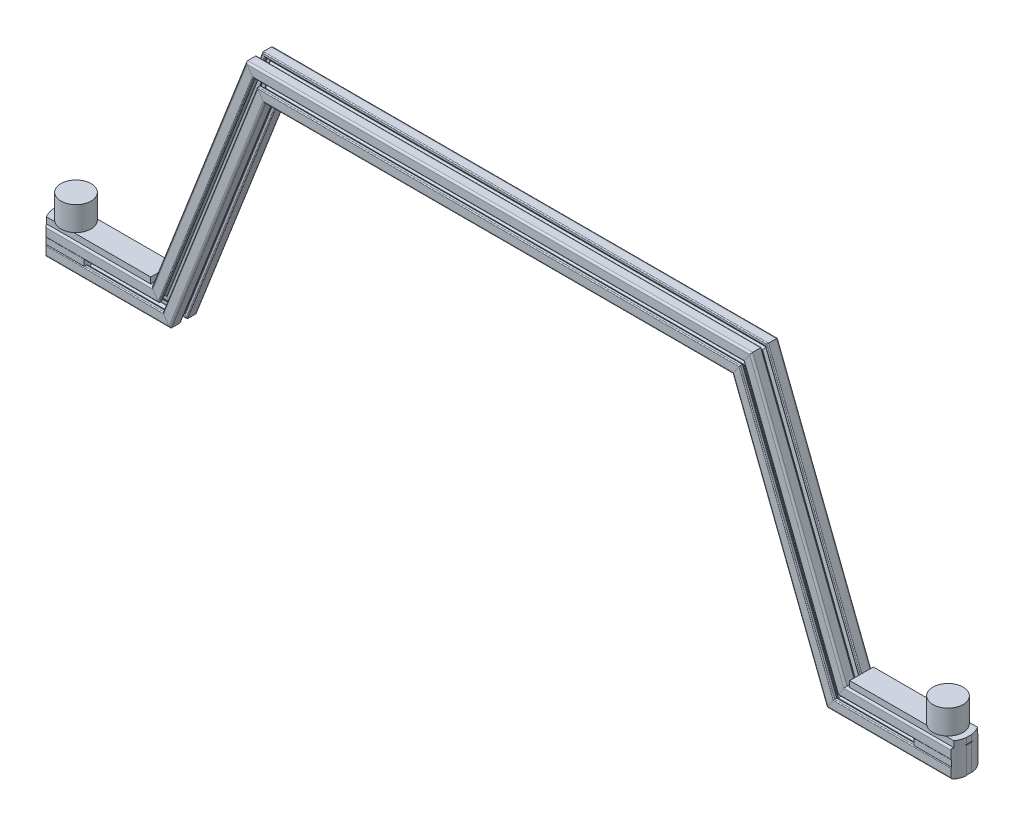
from build123d import *

# Parameters (mm, degrees)
SKETCH3_W           = 177.95649801978897
SKETCH3_H           = 38.99999999999999
BOSS_EXTRUDE1_DEPTH = 10
SKETCH4_R           = 25.000000000000004
BOSS_EXTRUDE2_DEPTH = 40
BOSS_EXTRUDE3_DEPTH = 70
CUT_EXTRUDE1_REACH  = 853.071


with BuildPart() as part:
    # Sweep1: sweep along a path in Sketch1
    with BuildLine(Plane.XY) as sweep1_path:
        Line((0, 0), (200, 0))
        Line((200, 0), (355.8974358974359, 400))
        Line((355.8974358974359, 400), (755.8974358974359, 400))
    # Sketch7 → Sweep1 (sweep)
    with BuildSketch(Plane(origin=(0, 0, 0), x_dir=(0, 0, -1), z_dir=(1, 0, 0))):
        with BuildLine():
            Line((4.905816029016867, 11.21531925961758), (4.005816102684597, 10.70017121598502))
            Line((4.005816102684597, 10.70017121598502), (3.105816176352211, 11.21531925961758))
            Line((3.105816176352211, 11.21531925961758), (-2.1975082146962652, 11.215319259617562))
            ThreePointArc((-2.1975082146962652, 11.215319259617562), (-2.3429279189949894, 11.244245037263257), (-2.4662087915471362, 11.326618682766647))
            Line((-2.4662087915471362, 11.326618682766647), (-5.932884474166096, 14.79329436538555))
            ThreePointArc((-5.932884474166096, 14.79329436538555), (-6.015258119669531, 14.9165752379377), (-6.044183897315248, 15.06199494223645))
            Line((-6.044183897315248, 15.06199494223645), (-6.044183897315358, 19.35531925961757))
            ThreePointArc((-6.044183897315358, 19.35531925961757), (-5.93288447416625, 19.62401983646846), (-5.664183897315362, 19.73531925961757))
            Line((-5.664183897315362, 19.73531925961757), (-2.5791838973153265, 19.73531925961757))
            ThreePointArc((-2.5791838973153265, 19.73531925961757), (-1.5043815899117716, 20.180516952214003), (-1.0591838973153256, 21.25531925961755))
            Line((-1.0591838973153256, 21.25531925961755), (-1.059183897315572, 24.21531925961759))
            ThreePointArc((-1.059183897315572, 24.21531925961759), (-1.504381589912015, 25.290121567021124), (-2.579183897315554, 25.73531925961756))
            Line((-2.579183897315554, 25.73531925961756), (-15.4941838973154, 25.73531925961757))
            ThreePointArc((-15.4941838973154, 25.73531925961757), (-17.61550424087504, 24.85663960317721), (-18.4941838973154, 22.735319259617572))
            Line((-18.4941838973154, 22.735319259617572), (-18.4941838973154, 9.820319259617662))
            ThreePointArc((-18.4941838973154, 9.820319259617662), (-18.048986204718968, 8.745516952214107), (-16.97418389731542, 8.300319259617662))
            Line((-16.97418389731542, 8.300319259617662), (-14.014183897315382, 8.300319259617766))
            ThreePointArc((-14.014183897315382, 8.300319259617766), (-12.939381589911845, 8.745516952214206), (-12.494183897315379, 9.820319259617733))
            Line((-12.494183897315379, 9.820319259617733), (-12.4941838973154, 12.90531925961758))
            ThreePointArc((-12.4941838973154, 12.90531925961758), (-12.382884474166298, 13.17401983646847), (-12.11418389731541, 13.285319259617582))
            Line((-12.11418389731541, 13.285319259617582), (-7.81378851212248, 13.28531925961746))
            ThreePointArc((-7.81378851212248, 13.28531925961746), (-7.668368807823728, 13.256393481971749), (-7.545087935271565, 13.17401983646833))
            Line((-7.545087935271565, 13.17401983646833), (-4.08548332046457, 9.714415221661511))
            ThreePointArc((-4.08548332046457, 9.714415221661511), (-4.003109674961121, 9.591134349109351), (-3.974183897315418, 9.445714644810582))
            Line((-3.974183897315418, 9.445714644810582), (-3.9741838973154215, 4.135318894911249))
            Line((-3.9741838973154215, 4.135318894911249), (-3.454570627598921, 3.235319259617511))
            Line((-3.454570627598921, 3.235319259617511), (-3.9741838973154215, 2.335319624323374))
            Line((-3.9741838973154215, 2.335319624323374), (-3.9741838973154215, -2.968005057763236))
            ThreePointArc((-3.9741838973154215, -2.968005057763236), (-4.003109674961133, -3.1134247620619817), (-4.0854833204645455, -3.236705634614141))
            Line((-4.0854833204645455, -3.236705634614141), (-7.55215900308344, -6.703381317233124))
            ThreePointArc((-7.55215900308344, -6.703381317233124), (-7.675439875635574, -6.785754962736517), (-7.820859579934288, -6.81468074038222))
            Line((-7.820859579934288, -6.81468074038222), (-12.11418389731541, -6.814680740382358))
            ThreePointArc((-12.11418389731541, -6.814680740382358), (-12.382884474166277, -6.703381317233245), (-12.494183897315413, -6.4346807403823885))
            Line((-12.494183897315413, -6.4346807403823885), (-12.4941838973154, -3.349680740382297))
            ThreePointArc((-12.4941838973154, -3.349680740382297), (-12.939381589911832, -2.274878432978741), (-14.014183897315382, -1.8296807403822957))
            Line((-14.014183897315382, -1.8296807403822957), (-16.97418389731542, -1.829680740382543))
            ThreePointArc((-16.97418389731542, -1.829680740382543), (-18.04898620471899, -2.2748784329789906), (-18.49418389731542, -3.349680740382567))
            Line((-18.49418389731542, -3.349680740382567), (-18.4941838973154, -16.26468074038243))
            ThreePointArc((-18.4941838973154, -16.26468074038243), (-17.615504240875044, -18.386001083942077), (-15.4941838973154, -19.264680740382435))
            Line((-15.4941838973154, -19.264680740382435), (-2.57918389731544, -19.26468074038243))
            ThreePointArc((-2.57918389731544, -19.26468074038243), (-1.5043815899118904, -18.819483047785972), (-1.059183897315442, -17.74468074038242))
            Line((-1.059183897315442, -17.74468074038242), (-1.059183897315572, -14.78468074038241))
            ThreePointArc((-1.059183897315572, -14.78468074038241), (-1.5043815899120052, -13.709878432978856), (-2.579183897315554, -13.264680740382412))
            Line((-2.579183897315554, -13.264680740382412), (-5.664183897315362, -13.26468074038243))
            ThreePointArc((-5.664183897315362, -13.26468074038243), (-5.932884474166251, -13.15338131723332), (-6.044183897315363, -12.884680740382432))
            Line((-6.044183897315363, -12.884680740382432), (-6.044183897315244, -8.58428535518951))
            ThreePointArc((-6.044183897315244, -8.58428535518951), (-6.015258119669534, -8.438865650890763), (-5.932884474166121, -8.315584778338604))
            Line((-5.932884474166121, -8.315584778338604), (-2.473279859359261, -4.85598016353157))
            ThreePointArc((-2.473279859359261, -4.85598016353157), (-2.3499989868071354, -4.77360651802815), (-2.204579282508414, -4.744680740382445))
            Line((-2.204579282508414, -4.744680740382445), (3.105816176352211, -4.74468074038245))
            Line((3.105816176352211, -4.74468074038245), (4.005816102684597, -4.229532696749942))
            Line((4.005816102684597, -4.229532696749942), (4.9058160290169806, -4.74468074038245))
            Line((4.9058160290169806, -4.74468074038245), (10.20914042006546, -4.744680740382422))
            ThreePointArc((10.20914042006546, -4.744680740382422), (10.354560124364177, -4.773606518028121), (10.47784099691632, -4.855980163531502))
            Line((10.47784099691632, -4.855980163531502), (13.944516679535292, -8.322655846150411))
            ThreePointArc((13.944516679535292, -8.322655846150411), (14.02689032503872, -8.445936718702562), (14.05581610268444, -8.591356423001304))
            Line((14.05581610268444, -8.591356423001304), (14.05581610268455, -12.884680740382432))
            ThreePointArc((14.05581610268455, -12.884680740382432), (13.944516679535438, -13.153381317233318), (13.67581610268455, -13.26468074038243))
            Line((13.67581610268455, -13.26468074038243), (10.59081610268452, -13.26468074038243))
            ThreePointArc((10.59081610268452, -13.26468074038243), (9.516013795280966, -13.70987843297886), (9.070816102684521, -14.78468074038241))
            Line((9.070816102684521, -14.78468074038241), (9.070816102684764, -17.74468074038245))
            ThreePointArc((9.070816102684764, -17.74468074038245), (9.5160137952812, -18.819483047785987), (10.59081610268474, -19.264680740382424))
            Line((10.59081610268474, -19.264680740382424), (23.50581610268459, -19.26468074038243))
            ThreePointArc((23.50581610268459, -19.26468074038243), (25.627136446244233, -18.386001083942073), (26.50581610268459, -16.26468074038243))
            Line((26.50581610268459, -16.26468074038243), (26.50581610268448, -3.349680740382411))
            ThreePointArc((26.50581610268448, -3.349680740382411), (26.060618410088097, -2.2748784329789036), (24.985816102684634, -1.8296807403824098))
            Line((24.985816102684634, -1.8296807403824098), (22.02581610268446, -1.829680740382515))
            ThreePointArc((22.02581610268446, -1.829680740382515), (20.951013795280893, -2.2748784329789853), (20.50581610268446, -3.349680740382567))
            Line((20.50581610268446, -3.349680740382567), (20.50581610268448, -6.434680740382334))
            ThreePointArc((20.50581610268448, -6.434680740382334), (20.394516679535418, -6.703381317233182), (20.125816102684606, -6.814680740382337))
            Line((20.125816102684606, -6.814680740382337), (15.825420717491562, -6.814680740382217))
            ThreePointArc((15.825420717491562, -6.814680740382217), (15.680001013192856, -6.7857549627365215), (15.556720140640715, -6.703381317233152))
            Line((15.556720140640715, -6.703381317233152), (12.09711552583365, -3.24377670242626))
            ThreePointArc((12.09711552583365, -3.24377670242626), (12.014741880330227, -3.120495829874147), (11.985816102684492, -2.975076125575442))
            Line((11.985816102684492, -2.975076125575442), (11.9858161026845, 2.335319624323545))
            Line((11.9858161026845, 2.335319624323545), (11.46620283296811, 3.235319259617624))
            Line((11.46620283296811, 3.235319259617624), (11.98581610268461, 4.135318894911704))
            Line((11.98581610268461, 4.135318894911704), (11.98581610268461, 9.438643576998516))
            ThreePointArc((11.98581610268461, 9.438643576998516), (12.014741880330329, 9.584063281297267), (12.097115525833749, 9.70734415384943))
            Line((12.097115525833749, 9.70734415384943), (15.563791208452631, 13.174019836468371))
            ThreePointArc((15.563791208452631, 13.174019836468371), (15.687072081004764, 13.256393481971767), (15.832491785303478, 13.28531925961747))
            Line((15.832491785303478, 13.28531925961747), (20.1258161026846, 13.28531925961761))
            ThreePointArc((20.1258161026846, 13.28531925961761), (20.394516679535503, 13.174019836468457), (20.5058161026846, 12.905319259617526))
            Line((20.5058161026846, 12.905319259617526), (20.50581610268459, 9.820319259617548))
            ThreePointArc((20.50581610268459, 9.820319259617548), (20.951013795281032, 8.745516952213997), (22.02581610268458, 8.300319259617549))
            Line((22.02581610268458, 8.300319259617549), (24.98581610268461, 8.300319259617792))
            ThreePointArc((24.98581610268461, 8.300319259617792), (26.06061841008815, 8.74551695221421), (26.50581610268461, 9.820319259617733))
            Line((26.50581610268461, 9.820319259617733), (26.5058161026846, 22.735319259617572))
            ThreePointArc((26.5058161026846, 22.735319259617572), (25.627136446244233, 24.85663960317721), (23.50581610268459, 25.73531925961757))
            Line((23.50581610268459, 25.73531925961757), (10.59081610268463, 25.73531925961757))
            ThreePointArc((10.59081610268463, 25.73531925961757), (9.51601379528108, 25.29012156702114), (9.070816102684635, 24.21531925961759))
            Line((9.070816102684635, 24.21531925961759), (9.070816102684764, 21.25531925961758))
            ThreePointArc((9.070816102684764, 21.25531925961758), (9.51601379528119, 20.18051695221402), (10.59081610268474, 19.735319259617576))
            Line((10.59081610268474, 19.735319259617576), (13.67581610268455, 19.73531925961757))
            ThreePointArc((13.67581610268455, 19.73531925961757), (13.944516679535438, 19.624019836468456), (14.055816102684554, 19.35531925961757))
            Line((14.055816102684554, 19.35531925961757), (14.055816102684432, 15.05492387442464))
            ThreePointArc((14.055816102684432, 15.05492387442464), (14.026890325038721, 14.909504170125889), (13.944516679535301, 14.786223297573725))
            Line((13.944516679535301, 14.786223297573725), (10.484912064728451, 11.326618682766702))
            ThreePointArc((10.484912064728451, 11.326618682766702), (10.361631192176315, 11.244245037263312), (10.2162114878776, 11.215319259617608))
            Line((10.2162114878776, 11.215319259617608), (4.905816029016867, 11.21531925961758))
        make_face()
        with BuildLine():
            Line((13.969837884314126, 21.274341041247055), (13.529837884314462, 21.274341041247))
            ThreePointArc((13.529837884314462, 21.274341041247), (12.46917771253464, 21.713680869467176), (12.02983788431446, 22.774341041247))
            Line((12.02983788431446, 22.774341041247), (12.02983788431446, 23.27434104124714))
            ThreePointArc((12.02983788431446, 23.27434104124714), (12.469177712534641, 24.335001213026963), (13.529837884314462, 24.77434104124714))
            Line((13.529837884314462, 24.77434104124714), (23.1398378843142, 24.77434104124711))
            ThreePointArc((23.1398378843142, 24.77434104124711), (24.752041345419528, 24.10654450235244), (25.4198378843142, 22.49434104124711))
            Line((25.4198378843142, 22.49434104124711), (25.41983788431417, 12.8843410412473))
            ThreePointArc((25.41983788431417, 12.8843410412473), (24.98049805609399, 11.823680869467479), (23.91983788431417, 11.384341041247298))
            Line((23.91983788431417, 11.384341041247298), (23.41983788431416, 11.38434104124724))
            ThreePointArc((23.41983788431416, 11.38434104124724), (22.359177712534358, 11.823680869467406), (21.919837884314166, 12.884341041247197))
            Line((21.919837884314166, 12.884341041247197), (21.919837884314173, 13.32434104124721))
            ThreePointArc((21.919837884314173, 13.32434104124721), (21.62694466550073, 14.031447822433739), (20.919837884314216, 14.32434104124721))
            Line((20.919837884314216, 14.32434104124721), (15.34983788431423, 14.324341041247353))
            ThreePointArc((15.34983788431423, 14.324341041247353), (15.08113730746334, 14.435640464396453), (14.969837884314229, 14.70434104124734))
            Line((14.969837884314229, 14.70434104124734), (14.96983788431424, 20.27434104124706))
            ThreePointArc((14.96983788431424, 20.27434104124706), (14.676944665500747, 20.981447822433648), (13.969837884314126, 21.274341041247055))
        make_face(mode=Mode.SUBTRACT)
        with BuildLine():
            Line((21.95885966594362, -6.689680740382415), (21.95885966594362, -6.249680740382729))
            ThreePointArc((21.95885966594362, -6.249680740382729), (22.398199494163798, -5.189020568602908), (23.45885966594362, -4.74968074038273))
            Line((23.45885966594362, -4.74968074038273), (23.958859665943745, -4.749680740382729))
            ThreePointArc((23.958859665943745, -4.749680740382729), (25.01951983772356, -5.189020568602912), (25.458859665943738, -6.249680740382729))
            Line((25.458859665943738, -6.249680740382729), (25.45885966594368, -15.859680740382462))
            ThreePointArc((25.45885966594368, -15.859680740382462), (24.791063127048982, -17.471884201487782), (23.17885966594365, -18.13968074038246))
            Line((23.17885966594365, -18.13968074038246), (13.56885966594387, -18.13968074038243))
            ThreePointArc((13.56885966594387, -18.13968074038243), (12.50819949416405, -17.70034091216225), (12.068859665943872, -16.63968074038243))
            Line((12.068859665943872, -16.63968074038243), (12.06885966594381, -16.13968074038244))
            ThreePointArc((12.06885966594381, -16.13968074038244), (12.508199494163975, -15.079020568602633), (13.568859665943767, -14.63968074038244))
            Line((13.568859665943767, -14.63968074038244), (14.008859665943811, -14.63968074038243))
            ThreePointArc((14.008859665943811, -14.63968074038243), (14.715966447130349, -14.346787521568986), (15.008859665943808, -13.639680740382458))
            Line((15.008859665943808, -13.639680740382458), (15.00885966594392, -8.069680740382497))
            ThreePointArc((15.00885966594392, -8.069680740382497), (15.120159089093024, -7.800980163531606), (15.38885966594391, -7.689680740382494))
            Line((15.38885966594391, -7.689680740382494), (20.95885966594362, -7.6896807403825))
            ThreePointArc((20.95885966594362, -7.6896807403825), (21.6659664471302, -7.396787521569017), (21.95885966594362, -6.689680740382415))
        make_face(mode=Mode.SUBTRACT)
        with BuildLine():
            Line((-6.005162115685757, -14.678702522011942), (-5.565162115686073, -14.67870252201189))
            ThreePointArc((-5.565162115686073, -14.67870252201189), (-4.504501943906252, -15.118042350232068), (-4.065162115686071, -16.17870252201189))
            Line((-4.065162115686071, -16.17870252201189), (-4.065162115686073, -16.67870252201203))
            ThreePointArc((-4.065162115686073, -16.67870252201203), (-4.504501943906252, -17.739362693791854), (-5.565162115686073, -18.17870252201203))
            Line((-5.565162115686073, -18.17870252201203), (-15.175162115685803, -18.178702522012))
            ThreePointArc((-15.175162115685803, -18.178702522012), (-16.787365576791128, -17.510905983117325), (-17.4551621156858, -15.898702522012))
            Line((-17.4551621156858, -15.898702522012), (-17.4551621156858, -6.288702522012187))
            ThreePointArc((-17.4551621156858, -6.288702522012187), (-17.01582228746562, -5.228042350232365), (-15.9551621156858, -4.788702522012187))
            Line((-15.9551621156858, -4.788702522012187), (-15.45516211568583, -4.788702522012131))
            ThreePointArc((-15.45516211568583, -4.788702522012131), (-14.394501943906025, -5.228042350232296), (-13.95516211568583, -6.2887025220120885))
            Line((-13.95516211568583, -6.2887025220120885), (-13.9551621156858, -6.7287025220121))
            ThreePointArc((-13.9551621156858, -6.7287025220121), (-13.662268896872359, -7.4358093031986385), (-12.955162115685829, -7.728702522012101))
            Line((-12.955162115685829, -7.728702522012101), (-7.385162115685895, -7.7287025220122425))
            ThreePointArc((-7.385162115685895, -7.7287025220122425), (-7.116461538835007, -7.84000194516135), (-7.005162115685896, -8.108702522012237))
            Line((-7.005162115685896, -8.108702522012237), (-7.005162115685843, -13.67870252201194))
            ThreePointArc((-7.005162115685843, -13.67870252201194), (-6.71226889687236, -14.385809303198519), (-6.005162115685757, -14.678702522011942))
        make_face(mode=Mode.SUBTRACT)
        with BuildLine():
            Line((1.828915921783154, -2.488564033794063), (1.413170132153103, -2.3163564892297765))
            ThreePointArc((1.413170132153103, -2.3163564892297765), (0.8233361546720646, -1.6253071256103948), (1.0362699251979821, -0.7420673205067814))
            ThreePointArc((1.0362699251979821, -0.7420673205067814), (0.44670320424367826, -0.23761386930494943), (-0.05771663654724213, 0.351981608207141))
            ThreePointArc((-0.05771663654724213, 0.351981608207141), (-0.9409371706461417, 0.13910189708009613), (-1.6319522534634663, 0.7289276667633529))
            Line((-1.6319522534634663, 0.7289276667633529), (-1.8041597980277773, 1.144673456393433))
            ThreePointArc((-1.8041597980277773, 1.144673456393433), (-1.7325897121288976, 2.0503947527944133), (-0.957477943443773, 2.5243726953145917))
            ThreePointArc((-0.957477943443773, 2.5243726953145917), (-1.0176621136546347, 3.2979617778010164), (-0.9574338433371404, 4.071547428094972))
            ThreePointArc((-0.9574338433371404, 4.071547428094972), (-1.7324937595966465, 4.545549969724606), (-1.804045409097357, 5.451241222148561))
            Line((-1.804045409097357, 5.451241222148561), (-1.6318378645330658, 5.866987011778611))
            ThreePointArc((-1.6318378645330658, 5.866987011778611), (-0.940788500913663, 6.456820989259641), (-0.05754869581003179, 6.243887218733747))
            ThreePointArc((-0.05754869581003179, 6.243887218733747), (0.4469047553918468, 6.833453939687905), (1.0365002329039577, 7.337873780478677))
            ThreePointArc((1.0365002329039577, 7.337873780478677), (0.8236205217769148, 8.221094314577591), (1.4134462914601942, 8.912109397394914))
            Line((1.4134462914601942, 8.912109397394914), (1.8291920810902504, 9.084316941959186))
            ThreePointArc((1.8291920810902504, 9.084316941959186), (2.734913377491232, 9.012746856060335), (3.208891320011409, 8.23763508737521))
            ThreePointArc((3.208891320011409, 8.23763508737521), (3.982480402497697, 8.297819257585996), (4.7560660527915095, 8.237590987268506))
            ThreePointArc((4.7560660527915095, 8.237590987268506), (5.230068594421157, 9.01265090352799), (6.135759846845102, 9.084202553028694))
            Line((6.135759846845102, 9.084202553028694), (6.551505636475179, 8.911995008464404))
            ThreePointArc((6.551505636475179, 8.911995008464404), (7.141339613955897, 8.220945644845237), (6.928405843430371, 7.337705839741907))
            ThreePointArc((6.928405843430371, 7.337705839741907), (7.517972564384662, 6.83325238854008), (8.022392405175577, 6.243656911027995))
            ThreePointArc((8.022392405175577, 6.243656911027995), (8.90561293927449, 6.456536622155043), (9.59662802209183, 5.866710852471783))
            Line((9.59662802209183, 5.866710852471783), (9.768835566656085, 5.450965062841702))
            ThreePointArc((9.768835566656085, 5.450965062841702), (9.697265480757252, 4.545243766440708), (8.922153712072108, 4.071265823920541))
            ThreePointArc((8.922153712072108, 4.071265823920541), (8.982337882282934, 3.2976767414341053), (8.922109611965613, 2.5240910911401406))
            ThreePointArc((8.922109611965613, 2.5240910911401406), (9.697169528224983, 2.050088549510487), (9.76872117772571, 1.1443972970866416))
            Line((9.76872117772571, 1.1443972970866416), (9.596513633161447, 0.7286515074565642))
            ThreePointArc((9.596513633161447, 0.7286515074565642), (8.905464269542016, 0.13881752997559105), (8.022224464438398, 0.3517513005014714))
            ThreePointArc((8.022224464438398, 0.3517513005014714), (7.517771013236633, -0.23781542045279824), (6.928175535724686, -0.7422352612437741))
            ThreePointArc((6.928175535724686, -0.7422352612437741), (7.14105524685153, -1.6254557953426318), (6.551229477168359, -2.3164708781599113))
            Line((6.551229477168359, -2.3164708781599113), (6.1354836875382786, -2.4886784227241967))
            ThreePointArc((6.1354836875382786, -2.4886784227241967), (5.229762391137301, -2.4171083368253283), (4.755784448617146, -1.641996568140192))
            ThreePointArc((4.755784448617146, -1.641996568140192), (3.982195366130722, -1.7021807383512026), (3.2086097158367415, -1.6419524680338808))
            ThreePointArc((3.2086097158367415, -1.6419524680338808), (2.734607174207096, -2.4170123842933635), (1.828915921783154, -2.488564033794063))
        make_face(mode=Mode.SUBTRACT)
        with BuildLine():
            Line((-13.99418389731535, 13.285319259617525), (-13.99418389731529, 12.84531925961784))
            ThreePointArc((-13.99418389731529, 12.84531925961784), (-14.43352372553547, 11.784659087838019), (-15.49418389731529, 11.34531925961784))
            Line((-15.49418389731529, 11.34531925961784), (-15.994183897315432, 11.34531925961784))
            ThreePointArc((-15.994183897315432, 11.34531925961784), (-17.05484406909525, 11.78465908783802), (-17.49418389731543, 12.84531925961784))
            Line((-17.49418389731543, 12.84531925961784), (-17.4941838973154, 22.45531925961757))
            ThreePointArc((-17.4941838973154, 22.45531925961757), (-16.826387358420728, 24.0675227207229), (-15.2141838973154, 24.735319259617572))
            Line((-15.2141838973154, 24.735319259617572), (-5.604183897315587, 24.73531925961757))
            ThreePointArc((-5.604183897315587, 24.73531925961757), (-4.543523725535764, 24.29597943139739), (-4.104183897315586, 23.23531925961757))
            Line((-4.104183897315586, 23.23531925961757), (-4.104183897315531, 22.735319259617572))
            ThreePointArc((-4.104183897315531, 22.735319259617572), (-4.543523725535693, 21.674659087837767), (-5.604183897315486, 21.235319259617572))
            Line((-5.604183897315486, 21.235319259617572), (-6.0441838973155, 21.23531925961757))
            ThreePointArc((-6.0441838973155, 21.23531925961757), (-6.751290678502038, 20.942426040804126), (-7.0441838973155, 20.235319259617597))
            Line((-7.0441838973155, 20.235319259617597), (-7.044183897315642, 14.66531925961763))
            ThreePointArc((-7.044183897315642, 14.66531925961763), (-7.155483320464751, 14.396618682766743), (-7.424183897315638, 14.28531925961763))
            Line((-7.424183897315638, 14.28531925961763), (-12.99418389731535, 14.28531925961758))
            ThreePointArc((-12.99418389731535, 14.28531925961758), (-13.701290678501918, 13.992426040804109), (-13.99418389731535, 13.285319259617525))
        make_face(mode=Mode.SUBTRACT)
    sweep1 = sweep(path=sweep1_path.line, transition=Transition.RIGHT)

    # Sketch3 → Boss-Extrude1 (add)
    with BuildSketch(Plane(origin=(0, 25.73531925961756, -1.383e-14), x_dir=(1, 0, 0), z_dir=(0, 1, -5.4e-16))):
        with Locations((88.97824900989448, 4.005816102684581)):
            Rectangle(SKETCH3_W, SKETCH3_H)
    boss_extrude1 = extrude(amount=BOSS_EXTRUDE1_DEPTH)

    # Sketch4 → Boss-Extrude2 (add)
    with BuildSketch(Plane(origin=(0, 35.73531925961756, -1.907e-14), x_dir=(1, 0, 0), z_dir=(0, 1, 1.702e-14))):
        with Locations(Location((35, 4.005816102684582, 0), (0, 0, 51.260575402))):
            Circle(SKETCH4_R)
    boss_extrude2 = extrude(amount=BOSS_EXTRUDE2_DEPTH)

    # Sketch6 → Boss-Extrude3 (add)
    with BuildSketch(Plane.ZY):
        Polygon((-25.627136446244275, 24.856639603177168), (17.61550424087506, 24.85663960317721), (17.61550424087506, -18.38600108394207), (-25.627136446244272, -18.38600108394215), align=None)
    boss_extrude3 = extrude(amount=-BOSS_EXTRUDE3_DEPTH)

    # Cut-Extrude1: up to this face of the body (flat: up to its plane)
    cut_extrude1_end = Plane(part.part.faces().sort_by_distance((106.58392122, -19.26468074, 9.036683897))[0])
    # Sketch5 → Cut-Extrude1 (cut, up to the picked face)
    with BuildSketch(Plane(origin=(0, 35.73531925961756, -1.907e-14), x_dir=(1, 0, 0), z_dir=(0, 1, 1.702e-14)), mode=Mode.PRIVATE) as cut_extrude1_sk1:
        with BuildLine():
            Line((35, -31.22267467748556), (35.00000000000001, -74.8110137153759))
            Line((35.00000000000001, -74.8110137153759), (-61.224063346656976, -74.8110137153759))
            Line((-61.224063346656976, -74.8110137153759), (-61.224063346656976, 58.49210550464079))
            Line((-61.224063346656976, 58.49210550464079), (35.00000000000001, 58.49210550464079))
            Line((35.00000000000001, 58.49210550464079), (35, 39.23430688285472))
            ThreePointArc((35, 39.23430688285472), (-0.2284907801701337, 4.005816102684586), (35, -31.22267467748556))
        make_face()
    cut_extrude1_tool1 = split(extrude(cut_extrude1_sk1.sketch, amount=-CUT_EXTRUDE1_REACH, mode=Mode.PRIVATE), bisect_by=cut_extrude1_end, keep=Keep.BOTH, mode=Mode.PRIVATE)
    cut_extrude1 = cut_extrude1_tool1.solids().sort_by(Axis((-19.05495, 35.735319, 10.339668), (0, -1, -1.702e-14)))[0]
    add(cut_extrude1, mode=Mode.SUBTRACT)

    # Mirror1: Sweep1, Boss-Extrude1, Boss-Extrude2, Boss-Extrude3, Cut-Extrude1 across plane
    add(sweep1.mirror(Plane(origin=(755.8974358974358, 0, 0), x_dir=(0, 0, 1), z_dir=(1, 0, 0))))
    add(boss_extrude1.mirror(Plane(origin=(755.8974358974358, 0, 0), x_dir=(0, 0, 1), z_dir=(1, 0, 0))))
    add(boss_extrude2.mirror(Plane(origin=(755.8974358974358, 0, 0), x_dir=(0, 0, 1), z_dir=(1, 0, 0))))
    add(boss_extrude3.mirror(Plane(origin=(755.8974358974358, 0, 0), x_dir=(0, 0, 1), z_dir=(1, 0, 0))))
    add(cut_extrude1.mirror(Plane(origin=(755.8974358974358, 0, 0), x_dir=(0, 0, 1), z_dir=(1, 0, 0))), mode=Mode.SUBTRACT)


solid = part.part
